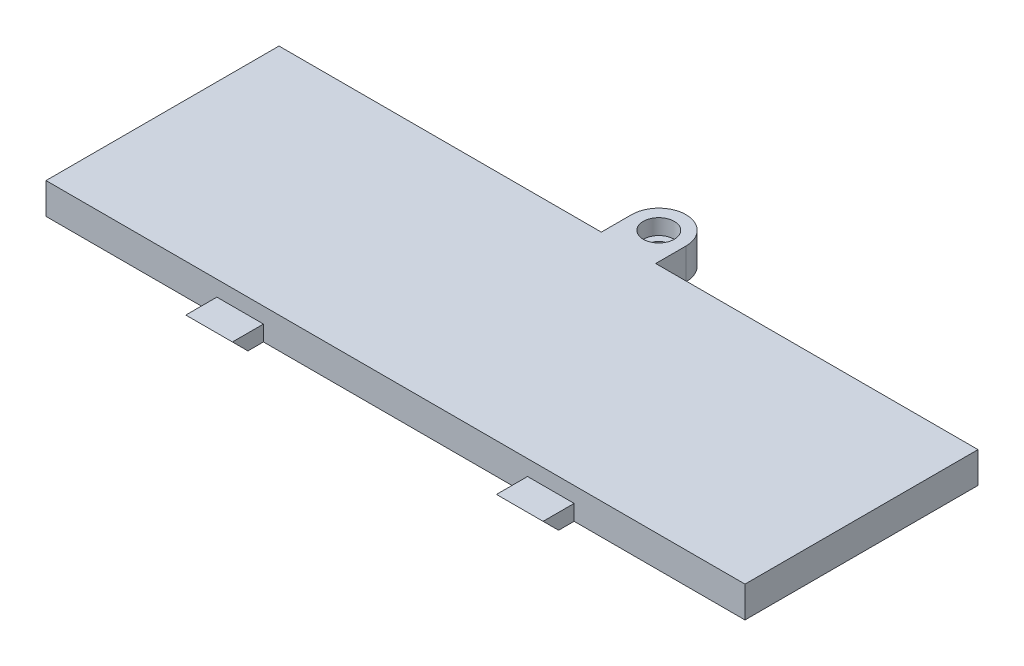
from build123d import *

# Parameters (mm, degrees)
SKETCH1_R           = 3.5
SKETCH1_W           = 90
SKETCH1_H           = 30
SKETCH1_W_2         = 7
SKETCH1_H_2         = 3.9
BOSS_EXTRUDE1_DEPTH = 4
SKETCH4_W           = 6
SKETCH4_H           = 2
BOSS_EXTRUDE2_DEPTH = 4
CHAMFER1_SIZE       = 2
CUT_EXTRUDE1_REACH  = 52.426
SKETCH5_R           = 1.1
SKETCH6_R           = 2
CUT_EXTRUDE2_DEPTH  = 2


with BuildPart() as part:
    # Sketch1 → Boss-Extrude1 (new body)
    with BuildSketch(Plane(origin=(0, 0, 0), x_dir=(1, 0, 0), z_dir=(0, 1, 0))):
        with Locations((0, 18.9)):
            Circle(SKETCH1_R)
        Rectangle(SKETCH1_W, SKETCH1_H)
        with Locations((0, 16.95)):
            Rectangle(SKETCH1_W_2, SKETCH1_H_2)
    extrude(amount=BOSS_EXTRUDE1_DEPTH)

    # Sketch4 → Boss-Extrude2 (add)
    with BuildSketch(Plane.XY.offset(15)):
        with Locations((-20, 1)):
            Rectangle(SKETCH4_W, SKETCH4_H)
        with Locations((20, 1)):
            Rectangle(SKETCH4_W, SKETCH4_H)
    extrude(amount=BOSS_EXTRUDE2_DEPTH)

    # Chamfer1
    chamfer1_edges = [part.edges().sort_by_distance(p)[0] for p in [
        (20, 0, 19),
        (-20, 0, 19),
    ]]
    chamfer(chamfer1_edges, length=CHAMFER1_SIZE - 0.0001)  # a hair under: the kernel refuses the full size

    # Sketch5 → Cut-Extrude1 (cut, up to next)
    with BuildSketch(Plane(origin=(0, 4, 0), x_dir=(1, 0, 0), z_dir=(0, 1, 0)), mode=Mode.PRIVATE) as cut_extrude1_sk1:
        with Locations(Location((0, 18.9, 0), (0, 0, 270))):
            Circle(SKETCH5_R)
    cut_extrude1_tool1 = extrude(cut_extrude1_sk1.sketch, amount=-CUT_EXTRUDE1_REACH, mode=Mode.PRIVATE) & part.part
    add(cut_extrude1_tool1.solids().sort_by_distance((0, 4, -18.9))[0], mode=Mode.SUBTRACT)

    # Sketch6 → Cut-Extrude2 (cut)
    with BuildSketch(Plane(origin=(0, 4, 0), x_dir=(1, 0, 0), z_dir=(0, 1, 0))):
        with Locations(Location((0, 18.9, 0), (0, 0, 270))):
            Circle(SKETCH6_R)
    extrude(amount=-CUT_EXTRUDE2_DEPTH, mode=Mode.SUBTRACT)


solid = part.part
